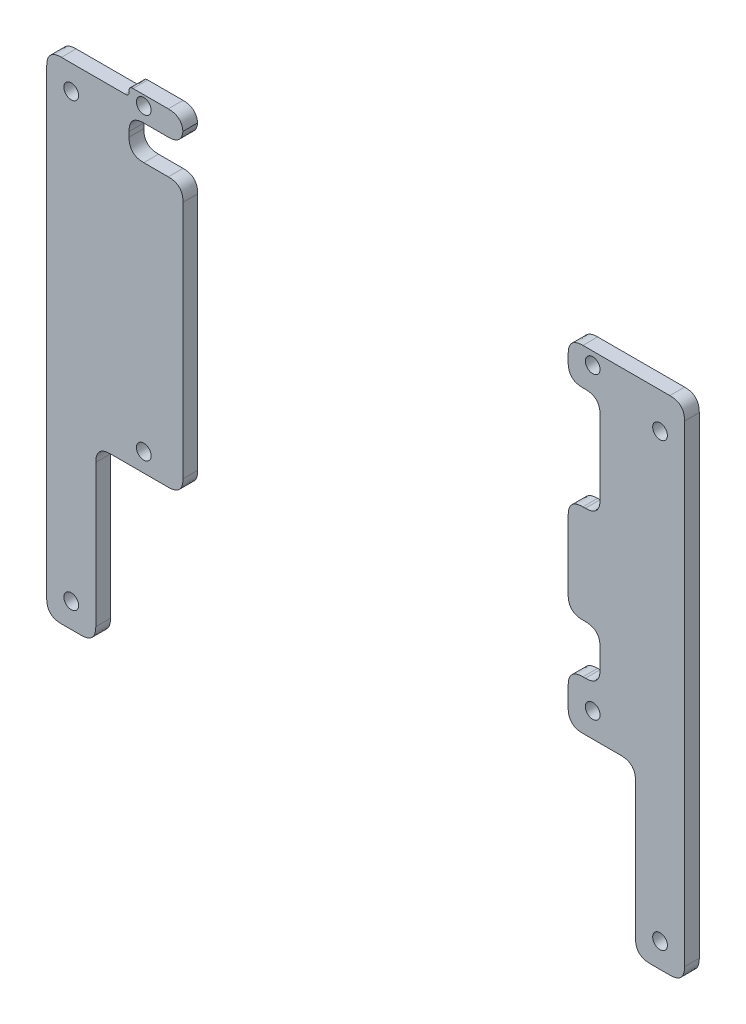
from build123d import *

# Parameters (mm, degrees)
SKETCH1_R             = 1.5
BOSS_EXTRUDE1_DEPTH   = 3
BOSS_EXTRUDE1_2_DEPTH = 3
FILLET1_SIZE          = 3
FILLET2_SIZE          = 3
FILLET3_SIZE          = 0.8


with BuildPart() as part:
    # Sketch1 → Boss-Extrude1 (new body)
    with BuildSketch(Plane.XY):
        Polygon((-89.339248371, 6.8), (-78.339248371, 6.8), (-78.339248371, 1.8), (-89.339248371, 1.8), (-89.339248371, -5.2), (-78.339248371, -5.2), (-78.339248371, -60), (-96.119248371, -60), (-96.119248371, -95), (-106.119248371, -95), (-106.119248371, 5), (-89.339248371, 5), align=None)
        with Locations((-101.119248371, 0)):
            Circle(SKETCH1_R, mode=Mode.SUBTRACT)
        with Locations((-101.119248371, -90)):
            Circle(SKETCH1_R, mode=Mode.SUBTRACT)
        with Locations((-86.339248371, 4.8)):
            Circle(SKETCH1_R, mode=Mode.SUBTRACT)
        with Locations((-86.339248371, -56.2)):
            Circle(SKETCH1_R, mode=Mode.SUBTRACT)
    extrude(amount=BOSS_EXTRUDE1_DEPTH)

    # Fillet2
    # a fillet whose section is not a circle: 3 mm, written as the material it adds along each edge
    with BuildSketch(Plane(origin=(-96.119248371, -60, 0), x_dir=(1, 0, 0), z_dir=(0, 0, 1)), Plane(origin=(-89.339248371, -5.2, 0), x_dir=(0, 1, 0), z_dir=(0, 0, 1)), Plane(origin=(-89.339248371, 1.8, 0), x_dir=(1, 0, 0), z_dir=(0, 0, 1))) as fillet2_piece_1:
        with BuildLine():
            Bezier((FILLET2_SIZE, 0), (0, 0), (0, -FILLET2_SIZE), weights=[1, 1, 1])
            Line((0, -FILLET2_SIZE), (0, 0))
            Line((0, 0), (FILLET2_SIZE, 0))
        make_face()
    extrude(amount=3)
    # a fillet whose section is not a circle: 3 mm, written as the material it takes off along each edge
    with BuildSketch(Plane(origin=(-106.119248371, 5, -7.5), x_dir=(1, 0, 0), z_dir=(0, 0, 1))) as fillet2_2_piece_1:
        with BuildLine():
            Bezier((FILLET2_SIZE, 0), (0, 0), (0, -FILLET2_SIZE), weights=[1, 1, 1])
            Line((0, -FILLET2_SIZE), (0, 0))
            Line((0, 0), (FILLET2_SIZE, 0))
        make_face()
    extrude(amount=18, mode=Mode.SUBTRACT)
    with BuildSketch(Plane(origin=(-78.339248371, 6.8, -7.5), x_dir=(-1, 0, 0), z_dir=(0, 0, 1)), Plane(origin=(-96.119248371, -95, -7.5), x_dir=(0, 1, 0), z_dir=(0, 0, 1)), Plane(origin=(-106.119248371, -95, -7.5), x_dir=(1, 0, 0), z_dir=(0, 0, 1)), Plane(origin=(-78.339248371, -60, -7.5), x_dir=(0, 1, 0), z_dir=(0, 0, 1)), Plane(origin=(-78.339248371, -5.2, -7.5), x_dir=(-1, 0, 0), z_dir=(0, 0, 1)), Plane(origin=(-78.339248371, 1.8, -7.5), x_dir=(0, 1, 0), z_dir=(0, 0, 1))) as fillet2_2_piece_2:
        with BuildLine():
            Bezier((FILLET2_SIZE, 0), (0, 0), (0, FILLET2_SIZE), weights=[1, 1, 1])
            Line((0, FILLET2_SIZE), (0, 0))
            Line((0, 0), (FILLET2_SIZE, 0))
        make_face()
    extrude(amount=18, mode=Mode.SUBTRACT)

    # Fillet3
    # a fillet whose section is not a circle: 0.8 mm, written as the material it adds along each edge
    with BuildSketch(Plane(origin=(-89.339248371, 5, 0), x_dir=(0, 1, 0), z_dir=(0, 0, 1))) as fillet3_piece_1:
        with BuildLine():
            Bezier((FILLET3_SIZE, 0), (0, 0), (0, FILLET3_SIZE), weights=[1, 1, 1])
            Line((0, FILLET3_SIZE), (0, 0))
            Line((0, 0), (FILLET3_SIZE, 0))
        make_face()
    extrude(amount=3)
    # a fillet whose section is not a circle: 0.8 mm, written as the material it takes off along each edge
    with BuildSketch(Plane(origin=(-89.339248371, 6.8, -2), x_dir=(1, 0, 0), z_dir=(0, 0, 1))) as fillet3_2_piece_1:
        with BuildLine():
            Bezier((FILLET3_SIZE, 0), (0, 0), (0, -FILLET3_SIZE), weights=[1, 1, 1])
            Line((0, -FILLET3_SIZE), (0, 0))
            Line((0, 0), (FILLET3_SIZE, 0))
        make_face()
    extrude(amount=7, mode=Mode.SUBTRACT)


with BuildPart() as body_2:
    # Sketch1 → Boss-Extrude1 2 (new body)
    with BuildSketch(Plane.XY):
        Polygon((23.880751629, -95), (23.880751629, 7.3), (0.160751629, 7.3), (0.160751629, -0.2), (6.660751629, -0.2), (6.660751629, -21.2), (0.160751629, -21.2), (0.160751629, -41.2), (6.660751629, -41.2), (6.660751629, -51.2), (0.160751629, -51.2), (0.160751629, -61.2), (13.880751629, -61.2), (13.880751629, -95), align=None)
        with Locations((18.880751629, 0)):
            Circle(SKETCH1_R, mode=Mode.SUBTRACT)
        with Locations((18.880751629, -90)):
            Circle(SKETCH1_R, mode=Mode.SUBTRACT)
        with Locations((5.160751629, -56.2)):
            Circle(SKETCH1_R, mode=Mode.SUBTRACT)
        with Locations((5.160751629, 4.8)):
            Circle(SKETCH1_R, mode=Mode.SUBTRACT)
    extrude(amount=BOSS_EXTRUDE1_2_DEPTH)

    # Fillet1
    # a fillet whose section is not a circle: 3 mm, written as the material it adds along each edge
    with BuildSketch(Plane(origin=(13.880751629, -61.2, 0), x_dir=(-1, 0, 0), z_dir=(0, 0, 1)), Plane(origin=(6.660751629, -51.2, 0), x_dir=(0, 1, 0), z_dir=(0, 0, 1)), Plane(origin=(6.660751629, -41.2, 0), x_dir=(-1, 0, 0), z_dir=(0, 0, 1)), Plane(origin=(6.660751629, -0.2, 0), x_dir=(-1, 0, 0), z_dir=(0, 0, 1)), Plane(origin=(6.660751629, -21.2, 0), x_dir=(0, 1, 0), z_dir=(0, 0, 1))) as fillet1_piece_1:
        with BuildLine():
            Bezier((FILLET1_SIZE, 0), (0, 0), (0, FILLET1_SIZE), weights=[1, 1, 1])
            Line((0, FILLET1_SIZE), (0, 0))
            Line((0, 0), (FILLET1_SIZE, 0))
        make_face()
    extrude(amount=3)
    # a fillet whose section is not a circle: 3 mm, written as the material it takes off along each edge
    with BuildSketch(Plane(origin=(23.880751629, -95, -7.5), x_dir=(0, 1, 0), z_dir=(0, 0, 1)), Plane(origin=(13.880751629, -95, -7.5), x_dir=(1, 0, 0), z_dir=(0, 0, 1))) as fillet1_2_piece_1:
        with BuildLine():
            Bezier((FILLET1_SIZE, 0), (0, 0), (0, FILLET1_SIZE), weights=[1, 1, 1])
            Line((0, FILLET1_SIZE), (0, 0))
            Line((0, 0), (FILLET1_SIZE, 0))
        make_face()
    extrude(amount=18, mode=Mode.SUBTRACT)
    with BuildSketch(Plane(origin=(0.160751629, -61.2, -7.5), x_dir=(0, 1, 0), z_dir=(0, 0, 1)), Plane(origin=(0.160751629, -51.2, -7.5), x_dir=(1, 0, 0), z_dir=(0, 0, 1)), Plane(origin=(0.160751629, -41.2, -7.5), x_dir=(0, 1, 0), z_dir=(0, 0, 1)), Plane(origin=(23.880751629, 7.3, -7.5), x_dir=(0, -1, 0), z_dir=(0, 0, 1)), Plane(origin=(0.160751629, 7.3, -7.5), x_dir=(1, 0, 0), z_dir=(0, 0, 1)), Plane(origin=(0.160751629, -0.2, -7.5), x_dir=(0, 1, 0), z_dir=(0, 0, 1)), Plane(origin=(0.160751629, -21.2, -7.5), x_dir=(1, 0, 0), z_dir=(0, 0, 1))) as fillet1_2_piece_2:
        with BuildLine():
            Bezier((FILLET1_SIZE, 0), (0, 0), (0, -FILLET1_SIZE), weights=[1, 1, 1])
            Line((0, -FILLET1_SIZE), (0, 0))
            Line((0, 0), (FILLET1_SIZE, 0))
        make_face()
    extrude(amount=18, mode=Mode.SUBTRACT)


solid = Compound([part.part, body_2.part])
